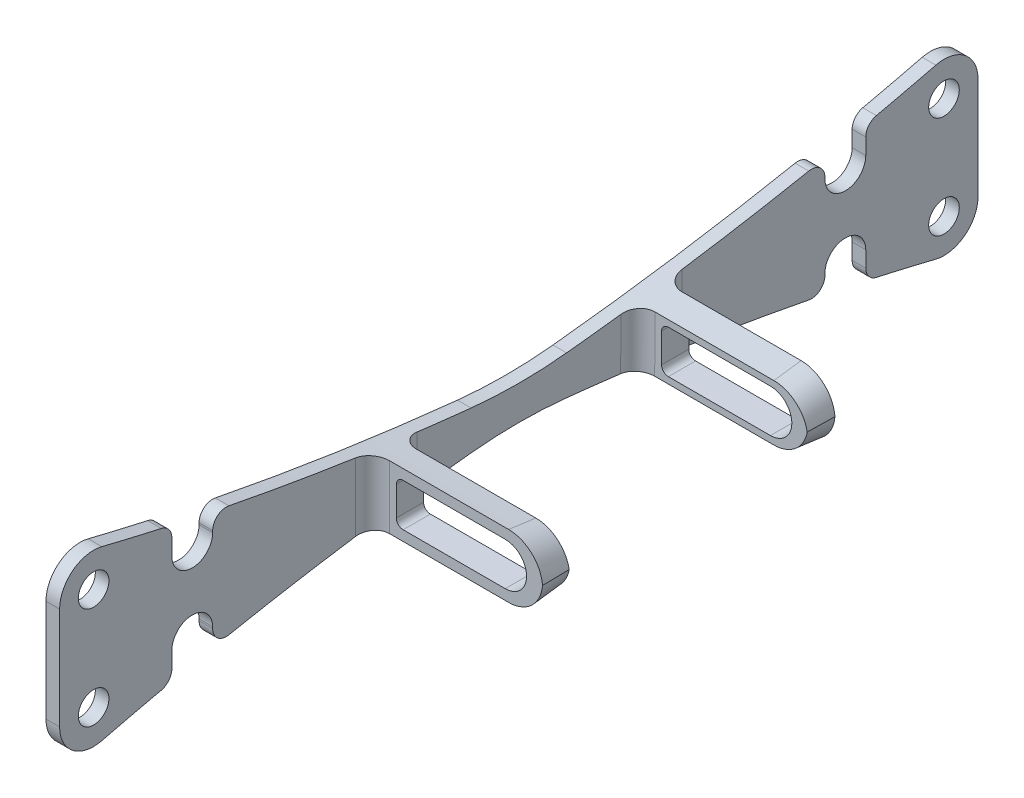
from build123d import *

# Parameters (mm, degrees)
SALIENTE_EXTRUIR1_DEPTH = 2
CORTAR_EXTRUIR1_START   = -2
CROQUIS2_R              = 2.2499999999999543
CROQUIS2_R_2            = 2.2499999999999525
CORTAR_EXTRUIR1_DEPTH   = 2
SALIENTE_EXTRUIR2_DEPTH = 25
REDONDEO1_R             = 5
REDONDEO2_R             = 2.5
CORTAR_EXTRUIR2_DEPTH   = 150
REDONDEO3_R             = 1
REDONDEO4_R             = 2


with BuildPart() as part:
    # Croquis1 → Saliente-Extruir1 (new body)
    with BuildSketch(Plane(origin=(-11.563192139466418, 0, 0), x_dir=(0, 0, -1), z_dir=(1, 0, 0))):
        with BuildLine():
            Line((-487.50000000000006, 61.20002010491962), (-487.50000000000006, 76.20002010491963))
            ThreePointArc((-487.50000000000006, 76.20002010491963), (-485.5828732625374, 80.13650234762473), (-481.3016430211471, 81.05429044671504))
            ThreePointArc((-481.3016430211471, 81.05429044671504), (-454.3213610685335, 75.37256140046077), (-427.01376608968735, 71.56297931460594))
            ThreePointArc((-427.01376608968735, 71.56297931460594), (-419.99597330488047, 71.19728769059765), (-412.9781919309264, 71.56319822849083))
            ThreePointArc((-412.9781919309264, 71.56319822849083), (-385.6746727662309, 75.37294023507445), (-358.6984109055162, 81.05427713370786))
            ThreePointArc((-358.6984109055162, 81.05427713370786), (-354.4171486029636, 80.13651947158925), (-352.50000000000006, 76.20002010491963))
            Line((-352.50000000000006, 76.20002010491963), (-352.50000000000006, 61.20002010491962))
            ThreePointArc((-352.50000000000006, 61.20002010491962), (-354.41718437935106, 57.26349272039885), (-358.698499139633, 56.3457848600743))
            ThreePointArc((-358.698499139633, 56.3457848600743), (-385.67550243814526, 62.027759813352475), (-412.9798133969885, 65.8380287540453))
            ThreePointArc((-412.9798133969885, 65.8380287540453), (-420, 66.20405869011226), (-427.02018660301155, 65.83802875404524))
            ThreePointArc((-427.02018660301155, 65.83802875404524), (-454.3244975618549, 62.027759813352304), (-481.3015008603671, 56.34578486007424))
            ThreePointArc((-481.3015008603671, 56.34578486007424), (-485.5828156206491, 57.2634927203988), (-487.50000000000006, 61.20002010491962))
        make_face()
    extrude(amount=SALIENTE_EXTRUIR1_DEPTH)

    # Croquis2 → Cortar-Extruir1 (cut)
    with BuildSketch(Plane(origin=(-9.563192139466418, 0, 0), x_dir=(0, 0, -1), z_dir=(1, 0, 0)).offset(CORTAR_EXTRUIR1_START)):
        with Locations((-357.50000000000006, 61.20002010491962)):
            Circle(CROQUIS2_R)
        with Locations((-482.50000000000006, 61.20002010491962)):
            Circle(CROQUIS2_R)
        with Locations((-482.50000000000006, 76.20002010491963)):
            Circle(CROQUIS2_R_2)
        with Locations((-357.50000000000006, 76.20002010491963)):
            Circle(CROQUIS2_R_2)
        with BuildLine():
            Line((-471.00000000000006, 74.70002010491963), (-471.00000000000006, 78.65520707766471))
            ThreePointArc((-471.00000000000006, 78.65520707766471), (-468.00242565546085, 78.0108082929201), (-465, 77.3894050999363))
            Line((-465, 77.3894050999363), (-465, 74.70002010491963))
            ThreePointArc((-465, 74.70002010491963), (-468, 71.70002010491957), (-471.00000000000006, 74.70002010491963))
        make_face()
        with BuildLine():
            Line((-471.00000000000006, 62.70002010491962), (-471.00000000000006, 58.745154173439786))
            ThreePointArc((-471.00000000000006, 58.745154173439786), (-468.0024260238705, 59.38964522535156), (-465, 60.011140542750915))
            Line((-465, 60.011140542750915), (-465, 62.70002010491962))
            ThreePointArc((-465, 62.70002010491962), (-468, 65.70002010491962), (-471.00000000000006, 62.70002010491962))
        make_face()
        with BuildLine():
            Line((-375.00000000000006, 74.70002010492064), (-375.00000000000006, 77.3892133718565))
            ThreePointArc((-375.00000000000006, 77.3892133718565), (-371.9975742047899, 78.0106515107218), (-369.00000000000006, 78.65508529549625))
            Line((-369.00000000000006, 78.65508529549625), (-369.00000000000006, 74.70002010492064))
            ThreePointArc((-369.00000000000006, 74.70002010492064), (-372.00000000000006, 71.70002010492064), (-375.00000000000006, 74.70002010492064))
        make_face()
        with BuildLine():
            Line((-375.00000000000006, 62.700020104920625), (-375.00000000000006, 60.01114054275103))
            ThreePointArc((-375.00000000000006, 60.01114054275103), (-371.9975739761297, 59.38964522535167), (-369.00000000000006, 58.74515417343995))
            Line((-369.00000000000006, 58.74515417343995), (-369.00000000000006, 62.700020104920625))
            ThreePointArc((-369.00000000000006, 62.700020104920625), (-372.00000000000006, 65.70002010492063), (-375.00000000000006, 62.700020104920625))
        make_face()
    extrude(amount=CORTAR_EXTRUIR1_DEPTH, mode=Mode.SUBTRACT)

    # Croquis3 → Saliente-Extruir2 (add)
    with BuildSketch(Plane(origin=(-9.563192139466418, 0, 0), x_dir=(0, 0, -1), z_dir=(1, 0, 0))):
        with BuildLine():
            Line((-441.5, 73.34478345263268), (-441.5, 64.0564693169966))
            ThreePointArc((-441.5, 64.0564693169966), (-439.500688579451, 64.33441688299206), (-437.50000000000006, 64.60227172023619))
            Line((-437.50000000000006, 64.60227172023619), (-437.50000000000006, 72.79909943134032))
            ThreePointArc((-437.50000000000006, 72.79909943134032), (-439.5006884273723, 73.06689509761537), (-441.5, 73.34478345263268))
        make_face()
        with BuildLine():
            Line((-402.51863522626155, 64.60471833694513), (-402.5055085249573, 72.7978713543057))
            ThreePointArc((-402.5055085249573, 72.7978713543057), (-400.5049833223084, 73.06563889552336), (-398.50583471542444, 73.34349747494228))
            Line((-398.50583471542444, 73.34349747494228), (-398.52070927713964, 64.05940108438512))
            ThreePointArc((-398.52070927713964, 64.05940108438512), (-400.5189846456923, 64.33710080901727), (-402.51863522626155, 64.60471833694513))
        make_face()
    extrude(amount=SALIENTE_EXTRUIR2_DEPTH)

    # Redondeo1
    # the kernel refuses this fillet: 5 mm, written as the material it takes off along each edge
    with BuildSketch(Plane(origin=(15.436807860533582, -331.99303473076, 454.57843031070206), x_dir=(0, 0.9852688696585968, -0.17101243955242207), z_dir=(0, -0.17101243955242207, -0.9852688696585968))) as redondeo1_piece_1:
        with BuildLine():
            CenterArc((400.0000000032307 + REDONDEO1_R, -REDONDEO1_R), REDONDEO1_R, 90, 90)
            Line((400.0000000032307 + REDONDEO1_R, 0), (400.0000000032307, 0))
            Line((400.0000000032307, 0), (400.0000000032307, -REDONDEO1_R))
        make_face()
    revolve(axis=Axis((15.436807860533582, -331.99303473076, 454.57843031070206), (1, 0, 0)), revolution_arc=4.158952056224013, mode=Mode.SUBTRACT)
    with BuildSketch(Plane(origin=(15.436807860533582, 469.39483943387535, 454.5712833464088), x_dir=(0, -0.9950753091360283, -0.09912178947051785), z_dir=(0, -0.09912178947051785, 0.9950753091360283))) as redondeo1_piece_2:
        with BuildLine():
            CenterArc((399.9999999970836 + REDONDEO1_R, -REDONDEO1_R), REDONDEO1_R, 90, 90)
            Line((399.9999999970836 + REDONDEO1_R, 0), (399.9999999970836, 0))
            Line((399.9999999970836, 0), (399.9999999970836, -REDONDEO1_R))
        make_face()
    revolve(axis=Axis((15.436807860533582, 469.39483943387535, 454.5712833464088), (1, 0, 0)), revolution_arc=4.159206104487057, mode=Mode.SUBTRACT)
    with BuildSketch(Plane(origin=(15.436807860533582, 469.3959177926432, 385.43308471259814), x_dir=(0, -0.9950750240944541, 0.09912465093719791), z_dir=(0, -0.09912465093719791, -0.9950750240944541))) as redondeo1_piece_3:
        with BuildLine():
            CenterArc((400.0000000023156 + REDONDEO1_R, REDONDEO1_R), REDONDEO1_R, 180, 90)
            Line((400.0000000023156 + REDONDEO1_R, 0), (400.0000000023156, 0))
            Line((400.0000000023156, 0), (400.0000000023156, REDONDEO1_R))
        make_face()
    revolve(axis=Axis((15.436807860533582, 469.3959177926432, 385.43308471259814), (-1, 0, 0)), revolution_arc=4.159253520630329, mode=Mode.SUBTRACT)
    with BuildSketch(Plane(origin=(15.436807860533582, -331.99303472992847, 385.4215696894115), x_dir=(0, 0.9852599261695624, 0.1710639584610054), z_dir=(0, -0.1710639584610054, 0.9852599261695624))) as redondeo1_piece_4:
        with BuildLine():
            CenterArc((400.00000000239186 + REDONDEO1_R, REDONDEO1_R), REDONDEO1_R, 180, 90)
            Line((400.00000000239186 + REDONDEO1_R, 0), (400.00000000239186, 0))
            Line((400.00000000239186, 0), (400.00000000239186, REDONDEO1_R))
        make_face()
    revolve(axis=Axis((15.436807860533582, -331.99303472992847, 385.4215696894115), (-1, 0, 0)), revolution_arc=4.159255812959428, mode=Mode.SUBTRACT)

    # Redondeo2
    redondeo2_edges = [part.edges().sort_by_distance(p)[0] for p in [
        (-9.563192139466418, 68.70062638481464, 441.5),
        (-9.563192139466418, 68.70068557578826, 437.50000000000006),
        (-9.563192139466418, 68.7014492796637, 398.51327199628207),
        (-9.563192139466418, 68.70129484562541, 402.5120718756094),
    ]]
    fillet(redondeo2_edges, radius=REDONDEO2_R)

    # Croquis4 → Cortar-Extruir2 (cut)
    with BuildSketch(Plane.XY.offset(441.5)):
        with BuildLine():
            Line((9.936807860533582, 71.84478345263268), (-6.063192139466418, 71.84478345263268))
            Line((-6.063192139466418, 71.84478345263268), (-6.063192139466418, 65.5564693169966))
            Line((-6.063192139466418, 65.5564693169966), (9.936807860533582, 65.55646931699658))
            ThreePointArc((9.936807860533582, 65.55646931699658), (13.080964928351639, 68.70062638481464), (9.936807860533582, 71.84478345263268))
        make_face()
    extrude(amount=-CORTAR_EXTRUIR2_DEPTH, mode=Mode.SUBTRACT)

    # Redondeo3
    redondeo3_edges = [part.edges().sort_by_distance(p)[0] for p in [
        (-6.063192139466418, 65.5564693169966, 439.5),
        (-6.063192139466418, 65.5564693169966, 400.51771055769314),
        (-6.063192139466418, 71.84478345263268, 439.5),
        (-6.063192139466418, 71.84478345263268, 400.5076357035813),
    ]]
    fillet(redondeo3_edges, radius=REDONDEO3_R)

    # Redondeo4
    redondeo4_edges = [part.edges().sort_by_distance(p)[0] for p in [
        (-10.563192139466418, 58.74515417343996, 369.00000000000006),
        (-10.563192139466418, 60.011140542751036, 375.00000000000006),
        (-10.563192139466418, 77.38921337185644, 375),
        (-10.563192139466418, 78.6550852954962, 369.00000000000006),
        (-10.563192139466418, 60.01114054275092, 465),
        (-10.563192139466418, 58.74515417343982, 471.00000000000006),
        (-10.563192139466418, 78.6552070776647, 471.00000000000006),
        (-10.563192139466418, 77.38940509993628, 465),
    ]]
    fillet(redondeo4_edges, radius=REDONDEO4_R)


solid = part.part
